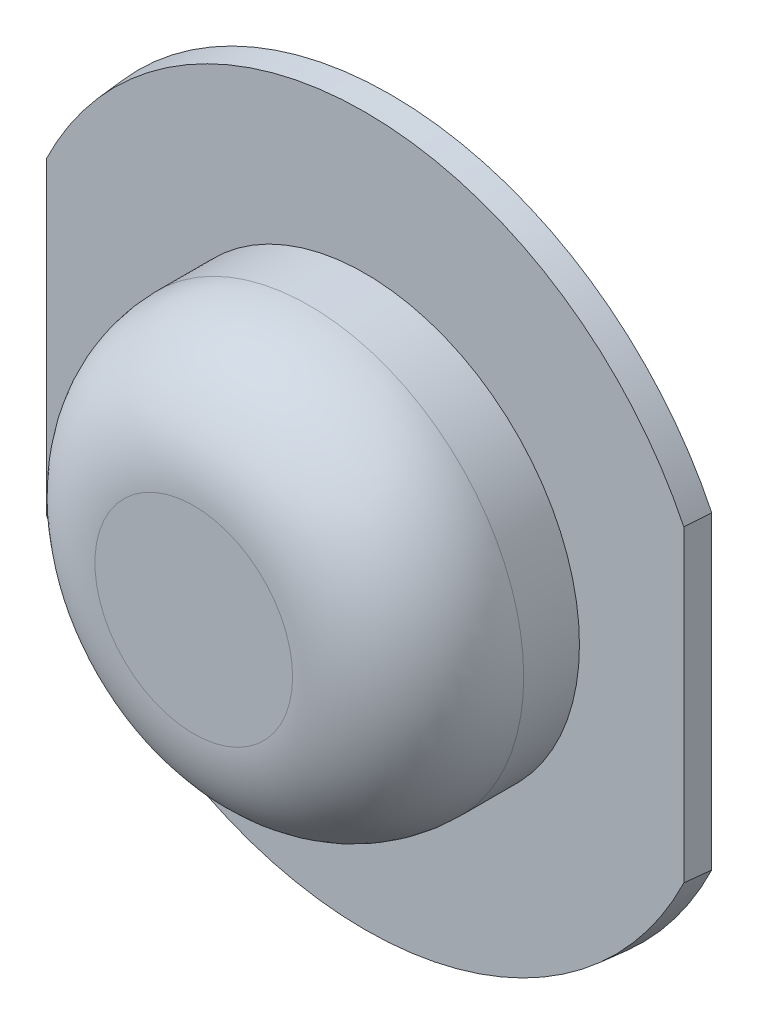
from build123d import *

# Parameters (mm, degrees)
BOSS_EXTRUDE1_DEPTH = 4
BOSS_EXTRUDE1_TAPER = 5
SKETCH6_W           = 52.54
SKETCH6_H           = 52.54
CUT_EXTRUDE2_DEPTH  = 2.35
CUT_EXTRUDE3_DEPTH  = 0.8
CIRPATTERN1_COUNT   = 4
SKETCH9_R           = 33.395
BOSS_EXTRUDE3_DEPTH = 26.68
FILLET2_R           = 18


with BuildPart() as part:
    # Sketch1 → Boss-Extrude1 (new body)
    with BuildSketch(Plane.XY):
        with BuildLine():
            ThreePointArc((50, 24.088378941), (0, 55.5), (-50, 24.088378941))
            Line((-50, 24.088378941), (-50, -24.088378941))
            ThreePointArc((-50, -24.088378941), (0, -55.5), (50, -24.088378941))
            Line((50, -24.088378941), (50, 24.088378941))
        make_face()
    extrude(amount=BOSS_EXTRUDE1_DEPTH, taper=BOSS_EXTRUDE1_TAPER)

    # Sketch6 → Cut-Extrude2 (cut)
    with BuildSketch(Plane(origin=(0, 0, 0), x_dir=(-1, 0, 0), z_dir=(0, 0, -1))):
        Rectangle(SKETCH6_W, SKETCH6_H)
    extrude(amount=-CUT_EXTRUDE2_DEPTH, mode=Mode.SUBTRACT)

    # Sketch7 → Cut-Revolve1 (revolve, cut)
    with BuildSketch(Plane(origin=(0, 0, 0), x_dir=(1, 0, 0), z_dir=(0, 1, 0))):
        with BuildLine():
            Line((0, -2.35), (0, -27.35))
            ThreePointArc((0, -27.35), (17.67766953, -20.02766953), (25, -2.35))
            Line((25, -2.35), (0, -2.35))
        make_face()
    revolve(axis=Axis((0, 0, 2.35), (0, 0, 1)), mode=Mode.SUBTRACT)

    # Sketch8 → Cut-Extrude3 (cut)
    with BuildSketch(Plane(origin=(0, 0, 2.35), x_dir=(-1, 0, 0), z_dir=(0, 0, -1))):
        with BuildLine():
            Line((-19.887048211, -15.149432777), (-15.149432777, -19.887048211))
            Line((-15.149432777, -19.887048211), (-17.801083206, -22.53869864))
            ThreePointArc((-17.801083206, -22.53869864), (-19.215296769, -23.124485078), (-20.629510331, -22.53869864))
            Line((-20.629510331, -22.53869864), (-22.53869864, -20.629510331))
            ThreePointArc((-22.53869864, -20.629510331), (-23.124485078, -19.215296769), (-22.53869864, -17.801083206))
            Line((-22.53869864, -17.801083206), (-19.887048211, -15.149432777))
        make_face()
    cut_extrude3 = extrude(amount=-CUT_EXTRUDE3_DEPTH, mode=Mode.SUBTRACT)

    # CirPattern1: Cut-Extrude3 ×4 about axis
    cirpattern1_axis = Axis((0, 0, 0), (0, 0, 1))
    for i in range(1, CIRPATTERN1_COUNT):
        add(cut_extrude3.rotate(cirpattern1_axis, i * 360 / CIRPATTERN1_COUNT), mode=Mode.SUBTRACT)

    # Sketch9 → Boss-Extrude3 (add)
    with BuildSketch(Plane.XY.offset(4)):
        Circle(SKETCH9_R)
    extrude(amount=BOSS_EXTRUDE3_DEPTH)

    # Fillet2
    fillet2_edges = [part.edges().sort_by_distance(p)[0] for p in [
        (-33.395, 0, 30.68),
    ]]
    fillet(fillet2_edges, radius=FILLET2_R)


solid = part.part
